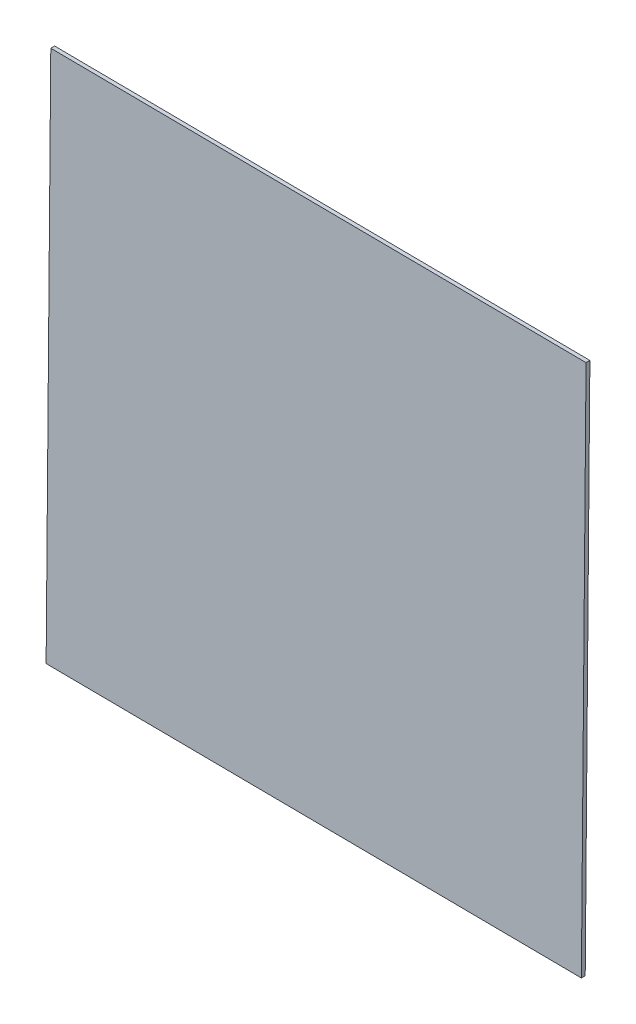
from build123d import *

# Parameters (mm, degrees)
BOSS_EXTRUDE1_DEPTH = 0.127


with BuildPart() as part:
    # Sketch1 → Boss-Extrude1 (new body)
    with BuildSketch(Plane.XY):
        Polygon((-97.71461971, 56.237094783), (-79.986094783, 56.08238029), (-79.83138029, 73.810905217), (-97.559905217, 73.96561971), align=None)
    extrude(amount=BOSS_EXTRUDE1_DEPTH)


solid = part.part
